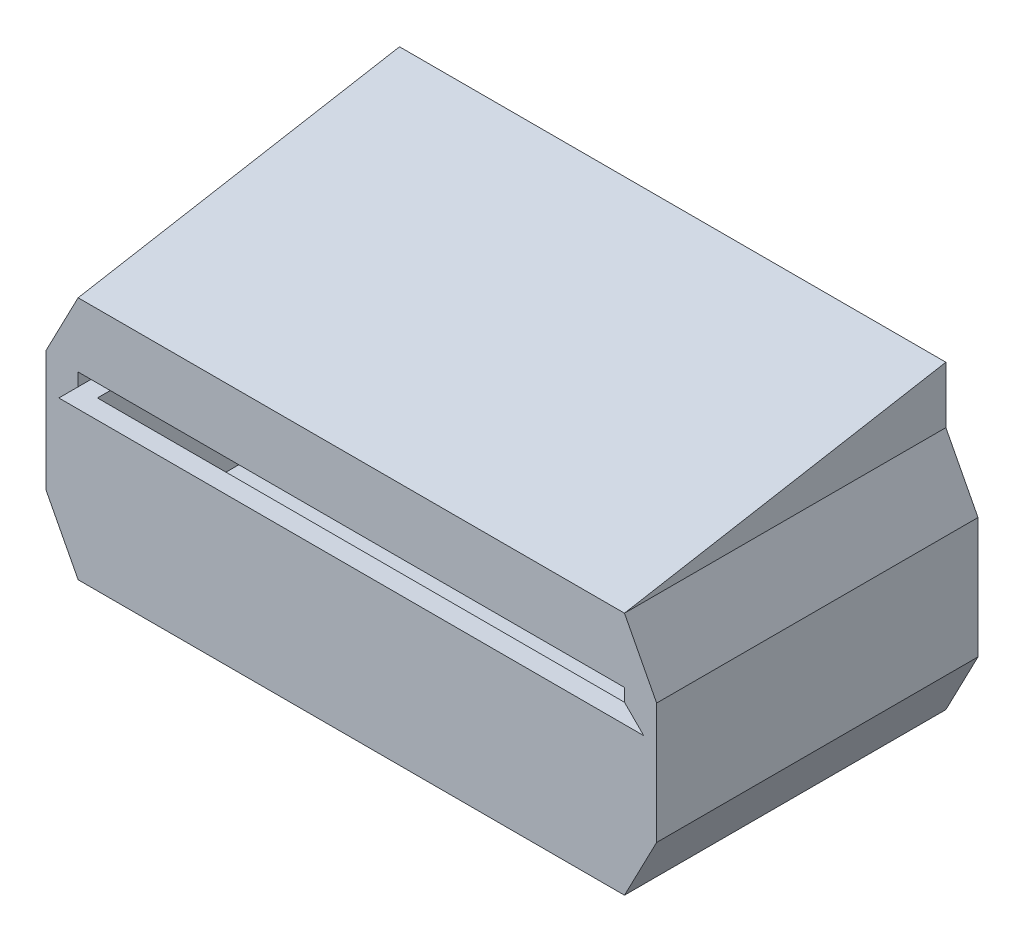
from build123d import *

# Parameters (mm, degrees)
SKETCH1_W                      = 85
SKETCH1_H                      = 90
BOSS_EXTRUDE1_BASE_DEPTH       = 3
BOSS_EXTRUDE4_SIDE_WALLS_DEPTH = 90
CUT_EXTRUDE2_GUIDE_HOLES_DEPTH = 133.830719339
SKETCH15_W                     = 85
SKETCH15_H                     = 20
BOSS_EXTRUDE9_REAR_WALL_DEPTH  = 3
BOSS_EXTRUDE1_START            = 3
SKETCH17_W                     = 85
SKETCH17_H                     = 3
BOSS_EXTRUDE1_REAR_WALL_DEPTH  = 12
SKETCH30_W                     = 85
SKETCH30_H                     = 2
CUT_EXTRUDE1_REAR_WALL_DEPTH   = 10
BOSS_EXTRUDE2_START            = 25
SKETCH20_W                     = 3
SKETCH20_H                     = 87
BOSS_EXTRUDE2_SIDE_WALL_DEPTH  = 10
CHAMFER1_SIDE_WALL_SIZE        = 3
BOSS_EXTRUDE5_SIDE_WALL_DEPTH  = 30
CHAMFER2_ROOF_SIZE             = 30
CHAMFER2_ROOF_SIZE_2           = 170.138454589
SKETCH28_W                     = 85
SKETCH28_H                     = 91.38839507
BOSS_EXTRUDE7_ROOF_DEPTH       = 3
SKETCH29_W                     = 8.082998623
SKETCH29_H                     = 55.59785115
CUT_EXTRUDE1_CLEAN_UP_DEPTH    = 142.848358117
SKETCH31_W                     = 95
SKETCH31_H                     = 40
CUT_EXTRUDE2_CLEAN_UP_DEPTH    = 139.209678755


# Some blends are built 0.0001 mm under size
with BuildPart() as part:
    # Sketch1 → Boss-Extrude1 (Base) (new body)
    with BuildSketch(Plane(origin=(0, 0, 0), x_dir=(1, 0, 0), z_dir=(0, 1, 0))):
        with Locations((42.5, 45)):
            Rectangle(SKETCH1_W, SKETCH1_H)
    extrude(amount=BOSS_EXTRUDE1_BASE_DEPTH)

    # Sketch5 → Boss-Extrude4 (Side Walls) (add, through all)
    with BuildSketch(Plane.XY):
        Polygon((-5, 28.390936655), (0, 38), (0, 0), (-5, 9.609063345), align=None)
        Polygon((90, 9.609063345), (90, 28.390936655), (85, 38), (85, 0), align=None)
    extrude(amount=-BOSS_EXTRUDE4_SIDE_WALLS_DEPTH)

    # Sketch4 → Cut-Extrude2 (Guide Holes) (cut, through all)
    with BuildSketch(Plane.XY):
        Polygon((-3, 23), (0, 26), (0, 23), align=None)
        Polygon((85, 23), (88, 23), (85, 26), align=None)
    extrude(amount=-CUT_EXTRUDE2_GUIDE_HOLES_DEPTH, mode=Mode.SUBTRACT)

    # Sketch15 → Boss-Extrude9 (Rear Wall) (add)
    with BuildSketch(Plane.XY):
        with Locations((42.5, 13)):
            Rectangle(SKETCH15_W, SKETCH15_H)
    extrude(amount=-BOSS_EXTRUDE9_REAR_WALL_DEPTH)

    # Sketch17 → Boss-Extrude1 (Rear Wall) (add)
    with BuildSketch(Plane(origin=(0, 23, 0), x_dir=(1, 0, 0), z_dir=(0, 1, 0)).offset(BOSS_EXTRUDE1_START)):
        with Locations((42.5, 1.5)):
            Rectangle(SKETCH17_W, SKETCH17_H)
    extrude(amount=BOSS_EXTRUDE1_REAR_WALL_DEPTH)

    # Sketch30 → Cut-Extrude1 (Rear Wall) (cut)
    with BuildSketch(Plane.XY):
        with Locations((42.5, 27)):
            Rectangle(SKETCH30_W, SKETCH30_H)
    extrude(amount=-CUT_EXTRUDE1_REAR_WALL_DEPTH, mode=Mode.SUBTRACT)

    # Sketch20 → Boss-Extrude2 (Side Wall) (add)
    with BuildSketch(Plane(origin=(0, 3, 0), x_dir=(1, 0, 0), z_dir=(0, 1, 0)).offset(BOSS_EXTRUDE2_START)):
        with Locations((1.5, 46.5)):
            Rectangle(SKETCH20_W, SKETCH20_H)
        with Locations((83.5, 46.5)):
            Rectangle(SKETCH20_W, SKETCH20_H)
    extrude(amount=BOSS_EXTRUDE2_SIDE_WALL_DEPTH)

    # Chamfer1 (Side Wall)
    chamfer1_side_wall_edges = [part.edges().sort_by_distance(p)[0] for p in [
        (82, 28, -46.5),
        (3, 28, -46.5),
    ]]
    chamfer(chamfer1_side_wall_edges, length=CHAMFER1_SIDE_WALL_SIZE - 0.0001)  # a hair under: the kernel refuses the full size

    # Sketch26 → Boss-Extrude5 (Side Wall) (add)
    with BuildSketch(Plane(origin=(0, 38, 0), x_dir=(1, 0, 0), z_dir=(0, 1, 0))):
        Polygon((0, 0), (0, 90), (3, 90), (3, 3), (82, 3), (82, 90), (85, 90), (85, 0), align=None)
    extrude(amount=BOSS_EXTRUDE5_SIDE_WALL_DEPTH)

    # Chamfer2 (Roof)
    # the kernel refuses this chamfer: 170.138454589, 30 mm, written as the material it takes off along each edge
    with BuildSketch(Plane(origin=(527.111375011, 68, 0), x_dir=(0, -0.9776715712462578, 0.21013876076743532), z_dir=(-1, 0, 0))) as chamfer2_roof_piece_1:
        Polygon((CHAMFER2_ROOF_SIZE * 0.977671571246, -CHAMFER2_ROOF_SIZE * 0.210138760767), (-CHAMFER2_ROOF_SIZE_2 * 0.210138760767, -CHAMFER2_ROOF_SIZE_2 * 0.977671571244), (0, 0), align=None)
    extrude(amount=969.222750023, mode=Mode.SUBTRACT)

    # Sketch28 → Boss-Extrude7 (Roof) (add)
    with BuildSketch(Plane(origin=(0, 36.854159795, 6.498382723), x_dir=(1, 0, 0), z_dir=(0, 0.9848077530122086, 0.17364817766692742))):
        with Locations((42.5, 52.292828286)):
            Rectangle(SKETCH28_W, SKETCH28_H)
    extrude(amount=-BOSS_EXTRUDE7_ROOF_DEPTH)

    # Sketch29 → Cut-Extrude1 (Clean up) (cut, through all)
    with BuildSketch(Plane(origin=(90, 0, 0), x_dir=(0, 0, -1), z_dir=(1, 0, 0))):
        with Locations((94.041499312, 27.798925575)):
            Rectangle(SKETCH29_W, SKETCH29_H)
    extrude(amount=-CUT_EXTRUDE1_CLEAN_UP_DEPTH, mode=Mode.SUBTRACT)

    # Sketch31 → Cut-Extrude2 (Clean Up) (cut, through all)
    with BuildSketch(Plane.XZ):
        with Locations((42.5, -70)):
            Rectangle(SKETCH31_W, SKETCH31_H)
    extrude(amount=-CUT_EXTRUDE2_CLEAN_UP_DEPTH, mode=Mode.SUBTRACT)


solid = part.part
